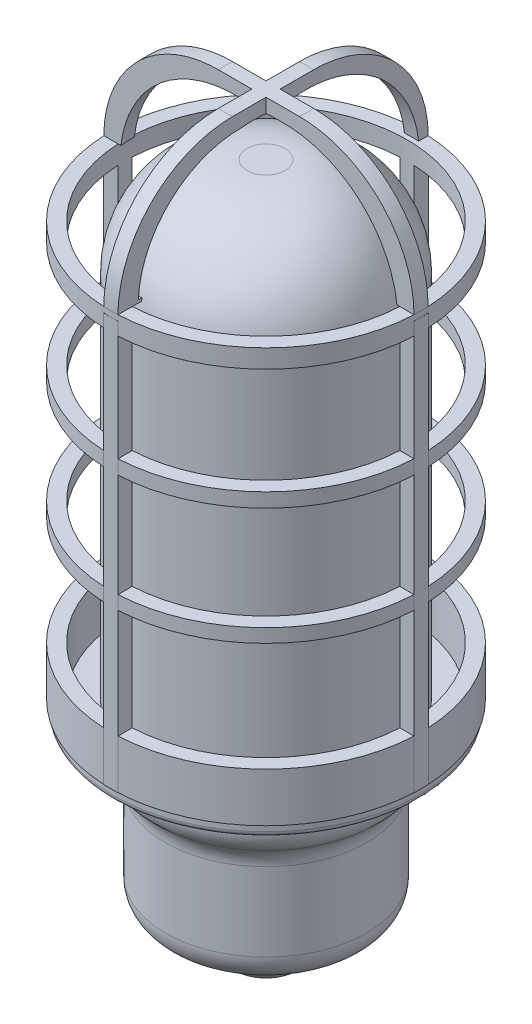
from build123d import *
from build123d.topology import SkipClean

# Parameters (mm, degrees)
SKETCH1_R               = 72.39
SKETCH1_R_2             = 65.786
BOSS_EXTRUDE1_DEPTH     = 22.86
SKETCH2_R               = 72.39
BOSS_EXTRUDE2_DEPTH     = 6.35
SKETCH3_R               = 72.39
BOSS_EXTRUDE3_DEPTH     = 6.604
SKETCH4_R               = 72.39
BOSS_EXTRUDE4_DEPTH     = 6.096
SKETCH6_R               = 65.786
CUT_EXTRUDE1_DEPTH      = 217.265749022
SKETCH7_W               = 6.604
SKETCH7_H               = 190.5
BOSS_EXTRUDE5_DEPTH     = 144.78
SKETCH8_W               = 6.604
SKETCH8_H               = 190.5
BOSS_EXTRUDE6_DEPTH     = 144.78
SKETCH9_R               = 65.786
CUT_EXTRUDE2_DEPTH      = 217.265749022
SKETCH10_R              = 72.39
BOSS_EXTRUDE7_DEPTH     = 55.88
FILLET1_R               = 53.34
SKETCH11_W              = 69.088
SKETCH11_H              = 69.088
CUT_EXTRUDE3_DEPTH      = 53.34
MIRROR2_COPY_1_SKETCH_W = 69.088
MIRROR2_COPY_1_SKETCH_H = 69.088
MIRROR2_COPY_1_DEPTH    = 53.34
SKETCH13_R              = 65.786
CUT_EXTRUDE4_DEPTH      = 2.54
SKETCH14_R              = 11.783981803
CUT_EXTRUDE5_DEPTH      = 46.736
CUT_EXTRUDE6_DEPTH      = 220.98
SKETCH15_R              = 54.61
BOSS_EXTRUDE8_DEPTH     = 217.932
FILLET4_R               = 45.72
SKETCH17_R              = 71.501
BOSS_EXTRUDE9_DEPTH     = 5.588
FILLET5_R               = 2.54
SKETCH18_R              = 55.88
BOSS_EXTRUDE10_DEPTH    = 21.7424
SKETCH19_R              = 46.99
BOSS_EXTRUDE11_DEPTH    = 57.658
SKETCH20_R              = 19.05
BOSS_EXTRUDE12_DEPTH    = 18.796
FILLET6_R               = 12.7
FILLET7_R               = 12.7
FILLET8_R               = 13.97
SKETCH21_R              = 12.319
CUT_EXTRUDE7_DEPTH      = 101.6
FILLET9_R               = 13.97


# Some blends are built 0.0001 mm under size
with BuildPart() as part:
    # Sketch1 → Boss-Extrude1 (new body)
    with BuildSketch(Plane(origin=(0, 0, 0), x_dir=(1, 0, 0), z_dir=(0, 1, 0))):
        with Locations(Location((0, 0, 0), (0, 0, 270))):
            Circle(SKETCH1_R)
        with Locations(Location((0, 0, 0), (0, 0, 270))):
            Circle(SKETCH1_R_2, mode=Mode.SUBTRACT)
    extrude(amount=BOSS_EXTRUDE1_DEPTH)



with BuildPart() as body_2:
    # Sketch2 → Boss-Extrude2 (new body)
    with BuildSketch(Plane(origin=(0, 73.66, 0), x_dir=(1, 0, 0), z_dir=(0, 1, 0))):
        with Locations(Location((0, 0, 0), (0, 0, 270))):
            Circle(SKETCH2_R)
    extrude(amount=BOSS_EXTRUDE2_DEPTH)


with BuildPart() as body_3:
    # Sketch3 → Boss-Extrude3 (new body)
    with BuildSketch(Plane(origin=(0, 128.27, 0), x_dir=(1, 0, 0), z_dir=(0, 1, 0))):
        with Locations(Location((0, 0, 0), (0, 0, 270))):
            Circle(SKETCH3_R)
    extrude(amount=BOSS_EXTRUDE3_DEPTH)


with BuildPart() as body_4:
    # Sketch4 → Boss-Extrude4 (new body)
    with BuildSketch(Plane(origin=(0, 184.404, 0), x_dir=(1, 0, 0), z_dir=(0, 1, 0))):
        with Locations(Location((0, 0, 0), (0, 0, 270))):
            Circle(SKETCH4_R)
    extrude(amount=BOSS_EXTRUDE4_DEPTH)


with BuildPart() as cut_extrude1_tool:
    # Sketch6 → Cut-Extrude1 (new, through all)
    with BuildSketch(Plane.XZ):
        with Locations(Location((0, 0, 0), (0, 0, 90))):
            Circle(SKETCH6_R)
    extrude(amount=-CUT_EXTRUDE1_DEPTH)


with BuildPart() as body_2_1:
    add(body_2.part)

    # Cut-Extrude1: cut by cut_extrude1_tool
    add(cut_extrude1_tool.part, mode=Mode.SUBTRACT)


with BuildPart() as body_3_1:
    add(body_3.part)

    # Cut-Extrude1: cut by cut_extrude1_tool
    add(cut_extrude1_tool.part, mode=Mode.SUBTRACT)


with BuildPart() as body_4_1:
    add(body_4.part)

    # Cut-Extrude1: cut by cut_extrude1_tool
    add(cut_extrude1_tool.part, mode=Mode.SUBTRACT)


with BuildPart() as part_1:
    add(part.part)

    add(body_2_1.part)  # Boss-Extrude5 merges body 2

    add(body_3_1.part)  # Boss-Extrude5 merges body 3

    add(body_4_1.part)  # Boss-Extrude5 merges body 4
    # Sketch7 → Boss-Extrude5 (add)
    with BuildSketch(Plane(origin=(72.39, 0, 0), x_dir=(0, 0, -1), z_dir=(1, 0, 0))):
        with Locations((0, 95.25)):
            Rectangle(SKETCH7_W, SKETCH7_H)
    extrude(amount=-BOSS_EXTRUDE5_DEPTH)

    # Sketch8 → Boss-Extrude6 (add)
    with BuildSketch(Plane.XY.offset(72.39)):
        with Locations((0, 95.25)):
            Rectangle(SKETCH8_W, SKETCH8_H)
    extrude(amount=-BOSS_EXTRUDE6_DEPTH)

    # Sketch9 → Cut-Extrude2 (cut, through all)
    with SkipClean():  # the faces are left unmerged after this step: merging them gives an invalid solid
        with BuildSketch(Plane.XZ):
            with Locations(Location((0, 0, 0), (0, 0, 270))):
                Circle(SKETCH9_R)
        extrude(amount=-CUT_EXTRUDE2_DEPTH, mode=Mode.SUBTRACT)
    add(part_1.part.scale(1), mode=Mode.REPLACE)  # the faces are merged on a copy

    # Sketch10 → Boss-Extrude7 (add)
    with SkipClean():  # the faces are left unmerged after this step: merging them gives an invalid solid
        with BuildSketch(Plane(origin=(0, 190.5, 0), x_dir=(1, 0, 0), z_dir=(0, 1, 0))):
            with Locations(Location((0, 0, 0), (0, 0, 270))):
                Circle(SKETCH10_R)
        extrude(amount=BOSS_EXTRUDE7_DEPTH)

    # Fillet1
    fillet1_edges = [part_1.edges().sort_by_distance(p)[0] for p in [
        (0, 246.38, -72.39),
    ]]
    fillet(fillet1_edges, radius=FILLET1_R)

    # Sketch11 → Cut-Extrude3 (cut)
    with SkipClean():  # the faces are left unmerged after this step: merging them gives an invalid solid
        with BuildSketch(Plane(origin=(0, 246.38, 0), x_dir=(1, 0, 0), z_dir=(0, 1, 0))):
            with Locations((37.846, -37.846)):
                Rectangle(SKETCH11_W, SKETCH11_H)
        cut_extrude3 = extrude(amount=-CUT_EXTRUDE3_DEPTH, mode=Mode.SUBTRACT)

    # Mirror1: Cut-Extrude3 across plane
    with SkipClean():  # the faces are left unmerged after this step: merging them gives an invalid solid
        add(cut_extrude3.mirror(Plane(origin=(0, 0, 0), x_dir=(0, 0, 1), z_dir=(1, 0, 0))), mode=Mode.SUBTRACT)

    # Mirror2: Cut-Extrude3 across plane
    with SkipClean():  # the faces are left unmerged after this step: merging them gives an invalid solid
        add(cut_extrude3.mirror(Plane.XY), mode=Mode.SUBTRACT)

    # Mirror2 copy 1 sketch → Mirror2 copy 1 (cut)
    with SkipClean():  # the faces are left unmerged after this step: merging them gives an invalid solid
        with BuildSketch(Plane(origin=(0, 246.38, 0), x_dir=(-1, 0, 0), z_dir=(0, 1, 0))):
            with Locations((37.846, -37.846)):
                Rectangle(MIRROR2_COPY_1_SKETCH_W, MIRROR2_COPY_1_SKETCH_H)
        extrude(amount=-MIRROR2_COPY_1_DEPTH, mode=Mode.SUBTRACT)

    # Sketch12 → Cut-Revolve1 (revolve, cut)
    with SkipClean():  # the faces are left unmerged after this step: merging them gives an invalid solid
        with BuildSketch(Plane(origin=(0, 0, -3.302), x_dir=(-1, 0, 0), z_dir=(0, 0, -1))):
            with BuildLine():
                Line((6.604, 239.776), (6.604, 193.04))
                Line((6.604, 193.04), (64.677914743, 193.04))
                ThreePointArc((64.677914743, 193.04), (45.320299897, 228.435501553), (6.604, 239.776))
            make_face()
        revolve(axis=Axis((0, 0, -3.302), (0, 1, 0)), mode=Mode.SUBTRACT)

    # Sketch13 → Cut-Extrude4 (cut)
    with BuildSketch(Plane.XZ.offset(-190.5)):
        with Locations(Location((0, 0, 0), (0, 0, 182.87705885))):
            Circle(SKETCH13_R)
    extrude(amount=-CUT_EXTRUDE4_DEPTH, mode=Mode.SUBTRACT)

    # Sketch14 → Cut-Extrude5 (cut)
    with BuildSketch(Plane.XZ.offset(-193.04)):
        Circle(SKETCH14_R)
    extrude(amount=-CUT_EXTRUDE5_DEPTH, mode=Mode.SUBTRACT)

    # Sketch16 → Cut-Extrude6 (cut)
    with BuildSketch(Plane(origin=(3.302, 0, 0), x_dir=(0, 0, -1), z_dir=(1, 0, 0))):
        with BuildLine():
            Line((-12.7, 239.734123295), (-12.7, 194.323714121))
            Line((-12.7, 194.323714121), (-62.87277141, 194.323714121))
            ThreePointArc((-62.87277141, 194.323714121), (-47.191189382, 227.420039898), (-12.7, 239.734123295))
        make_face()
    extrude(amount=-CUT_EXTRUDE6_DEPTH, mode=Mode.SUBTRACT)



with BuildPart() as body_2_2:
    # Sketch15 → Boss-Extrude8 (new body)
    with BuildSketch(Plane(origin=(0, 0, 0), x_dir=(1, 0, 0), z_dir=(0, 1, 0))):
        with Locations(Location((0, 0, 0), (0, 0, 270))):
            Circle(SKETCH15_R)
    extrude(amount=BOSS_EXTRUDE8_DEPTH)

    # Fillet4
    fillet4_edges = [body_2_2.edges().sort_by_distance(p)[0] for p in [
        (0, 217.932, -54.61),
    ]]
    fillet(fillet4_edges, radius=FILLET4_R)


with BuildPart() as part_2:
    add(part_1.part)

    add(body_2_2.part)  # Boss-Extrude9 merges body 2 2
    # Sketch17 → Boss-Extrude9 (add)
    with BuildSketch(Plane.XZ):
        with Locations(Location((0, 0, 0), (0, 0, 90))):
            Circle(SKETCH17_R)
    extrude(amount=BOSS_EXTRUDE9_DEPTH)

    # Fillet5
    fillet5_edges = [part_2.edges().sort_by_distance(p)[0] for p in [
        (0, -5.588, -71.501),
    ]]
    fillet(fillet5_edges, radius=FILLET5_R)

    # Sketch18 → Boss-Extrude10 (add)
    with BuildSketch(Plane.XZ.offset(5.588)):
        with Locations(Location((0, 0, 0), (0, 0, 270))):
            Circle(SKETCH18_R)
    extrude(amount=BOSS_EXTRUDE10_DEPTH)

    # Sketch19 → Boss-Extrude11 (add)
    with BuildSketch(Plane.XZ.offset(27.3304)):
        with Locations(Location((0, 0, 0), (0, 0, 90))):
            Circle(SKETCH19_R)
    extrude(amount=BOSS_EXTRUDE11_DEPTH)

    # Sketch20 → Boss-Extrude12 (add)
    with BuildSketch(Plane.XZ.offset(84.9884)):
        with Locations(Location((0, 0, 0), (0, 0, 270))):
            Circle(SKETCH20_R)
    extrude(amount=BOSS_EXTRUDE12_DEPTH)

    # Fillet6
    # the kernel refuses this fillet: 12.7 mm, written as the material it takes off along each edge
    with BuildSketch(Plane(origin=(0, -27.3304, 0), x_dir=(0, 0, -1), z_dir=(-1, 0, 0))) as fillet6_piece_1:
        with BuildLine():
            CenterArc((43.18, -12.115027858), FILLET6_R, 0, 72.542396876)
            Line((46.99, 0), (47.0662, 0.242300557))
            ThreePointArc((47.0662, 0.242300557), (51.435, 0.254), (55.88, 0.254))
            Line((55.88, 0.254), (56.134, 0))
            Line((56.134, 0), (56.134, -12.115027858))
            Line((56.134, -12.115027858), (55.88, -12.115027858))
        make_face()
    revolve(axis=Axis((0, -27.3304, 0), (0, -1, 0)), mode=Mode.SUBTRACT)

    # Fillet7
    fillet7_edges = [part_2.edges().sort_by_distance(p)[0] for p in [
        (46.99, -27.3304, 0),
    ]]
    fillet(fillet7_edges, radius=FILLET7_R)

    # Fillet8
    fillet8_edges = [part_2.edges().sort_by_distance(p)[0] for p in [
        (0, -84.9884, -46.99),
        (0, -84.9884, 19.05),
    ]]
    fillet(fillet8_edges, radius=FILLET8_R - 0.0001)  # a hair under: the kernel refuses the full size

    # Sketch21 → Cut-Extrude7 (cut)
    with BuildSketch(Plane.XZ.offset(103.7844)):
        with Locations(Location((0, 0, 0), (0, 0, 270))):
            Circle(SKETCH21_R)
    extrude(amount=-CUT_EXTRUDE7_DEPTH, mode=Mode.SUBTRACT)

    # Fillet9
    # the kernel refuses this fillet: 13.97 mm, written as the material it takes off along each edge
    with BuildSketch(Plane(origin=(0, -103.7844, 0), x_dir=(0, 0, -1), z_dir=(-1, 0, 0))) as fillet9_piece_1:
        with BuildLine():
            CenterArc((6.166625923, -12.54229617), FILLET9_R, 16.031823173, 47.838834936)
            Line((12.319, 0), (12.934237408, 1.254229617))
            ThreePointArc((12.934237408, 1.254229617), (15.6845, 1.397), (19.05, 1.397))
            Line((19.05, 1.397), (20.447, 0))
            ThreePointArc((20.447, 0), (20.447, -4.8261), (20.935979526, -8.298373087))
            Line((20.935979526, -8.298373087), (19.593311017, -8.684184276))
        make_face()
    revolve(axis=Axis((0, -103.7844, 0), (0, -1, 0)), mode=Mode.SUBTRACT)


solid = part_2.part
